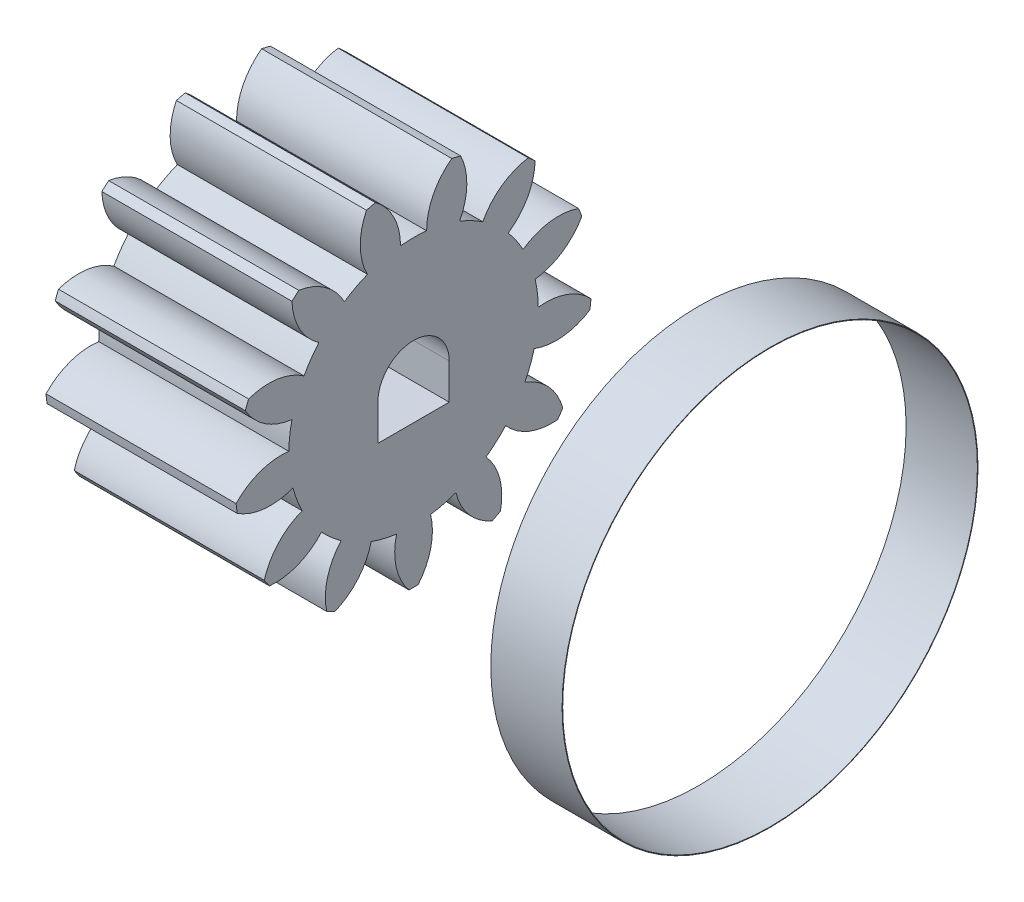
from build123d import *

# Parameters (mm, degrees)
CUT_EXTRUDE1_START         = -10
CUT_EXTRUDE1_DEPTH         = 10
CUT_EXTRUDE2_DEPTH         = 15.577379737
CUT_EXTRUDE3_DEPTH         = 15.577379737
CUT_EXTRUDE4_DEPTH         = 15.577379737
CUT_EXTRUDE5_DEPTH         = 15.577379737
CUT_EXTRUDE6_DEPTH         = 15.577379737
CUT_EXTRUDE7_DEPTH         = 15.577379737
CUT_EXTRUDE8_DEPTH         = 15.577379737
CUT_EXTRUDE9_DEPTH         = 15.577379737
CUT_EXTRUDE10_DEPTH        = 15.559932415
CUT_EXTRUDE11_DEPTH        = 15.559932415
CUT_EXTRUDE12_DEPTH        = 15.559932415
CUT_EXTRUDE13_DEPTH        = 15.559932415
F_0_8_0_8_DIAMETER_HOLE1_D = 0.8
SKETCH20_R                 = 8.75
BOSS_EXTRUDE2_DEPTH        = 3
BOSS_EXTRUDE3_START        = 10
BOSS_EXTRUDE3_DEPTH        = 10
CUT_EXTRUDE14_REACH        = 21.445
SKETCH23_R                 = 8.725
CUT_EXTRUDE15_DEPTH        = 8


with BuildPart() as part:
    # Cut-Extrude1: read off the stored shape, not the designer's step
    # Cut-Extrude1 outline → Cut-Extrude1 (new body)
    with BuildSketch(Plane(origin=(10, 0, 0), x_dir=(0, 0, -1), z_dir=(1, 0, 0)).offset(CUT_EXTRUDE1_START)):
        with BuildLine():
            ThreePointArc((5.115599083, 5.484582575), (-6.172378994, -4.2604856), (6.942190227, 2.838308449))
            ThreePointArc((6.942190227, 2.838308449), (5.736412412, 2.954786958), (4.608733854, 2.512284471))
            ThreePointArc((4.608733854, 2.512284471), (4.319842312, 2.981771856), (3.983306334, 3.41837266))
            ThreePointArc((3.983306334, 3.41837266), (4.796933675, 4.315856884), (5.115599083, 5.484582575))
        make_face()
    extrude(amount=CUT_EXTRUDE1_DEPTH)

    # Sketch3 → Cut-Extrude2 (cut, through all)
    with BuildSketch(Plane(origin=(10, 0, 0), x_dir=(0, 0, -1), z_dir=(1, 0, 0))):
        with BuildLine():
            ThreePointArc((7.466031873, -0.712999344), (7.445316556, 0.904025102), (7.078450644, 2.479019256))
            ThreePointArc((7.078450644, 2.479019256), (6.253152529, 1.592255251), (5.115639582, 1.175683915))
            ThreePointArc((5.115639582, 1.175683915), (5.21072888, 0.632697035), (5.24834797, 0.082732007))
            ThreePointArc((5.24834797, 0.082732007), (6.452498904, -0.049509856), (7.466031873, -0.712999344))
        make_face()
    extrude(amount=-CUT_EXTRUDE2_DEPTH, mode=Mode.SUBTRACT)

    # Sketch4 → Cut-Extrude3 (cut, through all)
    with BuildSketch(Plane(origin=(10, 0, 0), x_dir=(0, 0, -1), z_dir=(1, 0, 0))):
        with BuildLine():
            ThreePointArc((6.279495593, -4.10096758), (7.01262182, -2.659536653), (7.419714468, -1.094457498))
            ThreePointArc((7.419714468, -1.094457498), (6.276849497, -1.496112872), (5.076041451, -1.336339847))
            ThreePointArc((5.076041451, -1.336339847), (4.907900258, -1.861321052), (4.685628816, -2.365773362))
            ThreePointArc((4.685628816, -2.365773362), (5.690395658, -3.042464558), (6.279495593, -4.10096758))
        make_face()
    extrude(amount=-CUT_EXTRUDE3_DEPTH, mode=Mode.SUBTRACT)

    # Sketch5 → Cut-Extrude4 (cut, through all)
    with BuildSketch(Plane(origin=(10, 0, 0), x_dir=(0, 0, -1), z_dir=(1, 0, 0))):
        with BuildLine():
            ThreePointArc((3.654402549, -6.549453566), (4.973419937, -5.613830611), (6.061211124, -4.41720723))
            ThreePointArc((6.061211124, -4.41720723), (4.862595889, -4.241739566), (3.873583397, -3.542224254))
            ThreePointArc((3.873583397, -3.542224254), (3.480730833, -3.928932917), (3.049488568, -4.272308565))
            ThreePointArc((3.049488568, -4.272308565), (3.624691343, -5.338427296), (3.654402549, -6.549453566))
        make_face()
    extrude(amount=-CUT_EXTRUDE4_DEPTH, mode=Mode.SUBTRACT)

    # Sketch6 → Cut-Extrude5 (cut, through all)
    with BuildSketch(Plane(origin=(10, 0, 0), x_dir=(0, 0, -1), z_dir=(1, 0, 0))):
        with BuildLine():
            ThreePointArc((0.192129921, -7.497538669), (1.794867482, -7.282063631), (3.314157357, -6.728028018))
            ThreePointArc((3.314157357, -6.728028018), (2.334380164, -6.015634844), (1.783734068, -4.936627773))
            ThreePointArc((1.783734068, -4.936627773), (1.256167922, -5.0964736), (0.714747239, -5.200109363))
            ThreePointArc((0.714747239, -5.200109363), (0.728613924, -6.411420676), (0.192129921, -7.497538669))
        make_face()
    extrude(amount=-CUT_EXTRUDE5_DEPTH, mode=Mode.SUBTRACT)

    # Sketch7 → Cut-Extrude6 (cut, through all)
    with BuildSketch(Plane(origin=(10, 0, 0), x_dir=(0, 0, -1), z_dir=(1, 0, 0))):
        with BuildLine():
            ThreePointArc((-3.314157357, -6.728028018), (-1.794867482, -7.282063631), (-0.192129921, -7.497538669))
            ThreePointArc((-0.192129921, -7.497538669), (-0.728613924, -6.411420676), (-0.714747239, -5.200109363))
            ThreePointArc((-0.714747239, -5.200109363), (-1.256167922, -5.0964736), (-1.783734068, -4.936627773))
            ThreePointArc((-1.783734068, -4.936627773), (-2.334380164, -6.015634844), (-3.314157357, -6.728028018))
        make_face()
    extrude(amount=-CUT_EXTRUDE6_DEPTH, mode=Mode.SUBTRACT)

    # Sketch8 → Cut-Extrude7 (cut, through all)
    with BuildSketch(Plane(origin=(10, 0, 0), x_dir=(0, 0, -1), z_dir=(1, 0, 0))):
        with BuildLine():
            ThreePointArc((-6.061211124, -4.41720723), (-4.973419937, -5.613830611), (-3.654402549, -6.549453566))
            ThreePointArc((-3.654402549, -6.549453566), (-3.624691343, -5.338427296), (-3.049488568, -4.272308565))
            ThreePointArc((-3.049488568, -4.272308565), (-3.480730833, -3.928932917), (-3.873583397, -3.542224254))
            ThreePointArc((-3.873583397, -3.542224254), (-4.862595889, -4.241739566), (-6.061211124, -4.41720723))
        make_face()
    extrude(amount=-CUT_EXTRUDE7_DEPTH, mode=Mode.SUBTRACT)

    # Sketch9 → Cut-Extrude8 (cut, through all)
    with BuildSketch(Plane(origin=(10, 0, 0), x_dir=(0, 0, -1), z_dir=(1, 0, 0))):
        with BuildLine():
            ThreePointArc((-7.419714468, -1.094457498), (-7.01262182, -2.659536653), (-6.279495593, -4.10096758))
            ThreePointArc((-6.279495593, -4.10096758), (-5.690395658, -3.042464558), (-4.685628816, -2.365773362))
            ThreePointArc((-4.685628816, -2.365773362), (-4.907900258, -1.861321052), (-5.076041451, -1.336339847))
            ThreePointArc((-5.076041451, -1.336339847), (-6.276849497, -1.496112872), (-7.419714468, -1.094457498))
        make_face()
    extrude(amount=-CUT_EXTRUDE8_DEPTH, mode=Mode.SUBTRACT)

    # Sketch10 → Cut-Extrude9 (cut, through all)
    with BuildSketch(Plane(origin=(10, 0, 0), x_dir=(0, 0, -1), z_dir=(1, 0, 0))):
        with BuildLine():
            ThreePointArc((-7.078450644, 2.479019256), (-7.445316556, 0.904025102), (-7.466031873, -0.712999344))
            ThreePointArc((-7.466031873, -0.712999344), (-6.452498904, -0.049509856), (-5.24834797, 0.082732007))
            ThreePointArc((-5.24834797, 0.082732007), (-5.21072888, 0.632697035), (-5.115639582, 1.175683915))
            ThreePointArc((-5.115639582, 1.175683915), (-6.253152529, 1.592255251), (-7.078450644, 2.479019256))
        make_face()
    extrude(amount=-CUT_EXTRUDE9_DEPTH, mode=Mode.SUBTRACT)

    # Sketch11 → Cut-Extrude10 (cut, through all)
    with BuildSketch(Plane(origin=(10, 0, 0), x_dir=(0, 0, -1), z_dir=(1, 0, 0))):
        with BuildLine():
            ThreePointArc((-5.115599083, 5.484582575), (-6.172378994, 4.2604856), (-6.942190227, 2.838308449))
            ThreePointArc((-6.942190227, 2.838308449), (-5.736412412, 2.954786958), (-4.608733854, 2.512284471))
            ThreePointArc((-4.608733854, 2.512284471), (-4.319842312, 2.981771856), (-3.983306334, 3.41837266))
            ThreePointArc((-3.983306334, 3.41837266), (-4.796933675, 4.315856884), (-5.115599083, 5.484582575))
        make_face()
    extrude(amount=-CUT_EXTRUDE10_DEPTH, mode=Mode.SUBTRACT)

    # Sketch12 → Cut-Extrude11 (cut, through all)
    with BuildSketch(Plane(origin=(10, 0, 0), x_dir=(0, 0, -1), z_dir=(1, 0, 0))):
        with BuildLine():
            ThreePointArc((-1.980825421, 7.233694122), (-3.48542379, 6.640920192), (-4.827976462, 5.739393982))
            ThreePointArc((-4.827976462, 5.739393982), (-3.706182968, 5.282177689), (-2.913314353, 4.366302839))
            ThreePointArc((-2.913314353, 4.366302839), (-2.43933193, 4.647758679), (-1.93844561, 4.877953425))
            ThreePointArc((-1.93844561, 4.877953425), (-2.241795126, 6.050747718), (-1.980825421, 7.233694122))
        make_face()
    extrude(amount=-CUT_EXTRUDE11_DEPTH, mode=Mode.SUBTRACT)

    # Sketch13 → Cut-Extrude12 (cut, through all)
    with BuildSketch(Plane(origin=(10, 0, 0), x_dir=(0, 0, -1), z_dir=(1, 0, 0))):
        with BuildLine():
            ThreePointArc((1.607731473, 7.325653521), (0, 7.5), (-1.607731473, 7.325653521))
            ThreePointArc((-1.607731473, 7.325653521), (-0.82691167, 6.399485168), (-0.550489643, 5.220053846))
            ThreePointArc((-0.550489643, 5.220053846), (0, 5.249), (0.550489643, 5.220053846))
            ThreePointArc((0.550489643, 5.220053846), (0.82691167, 6.399485168), (1.607731473, 7.325653521))
        make_face()
    extrude(amount=-CUT_EXTRUDE12_DEPTH, mode=Mode.SUBTRACT)

    # Sketch14 → Cut-Extrude13 (cut, through all)
    with BuildSketch(Plane(origin=(10, 0, 0), x_dir=(0, 0, -1), z_dir=(1, 0, 0))):
        with BuildLine():
            ThreePointArc((4.827976462, 5.739393982), (3.48542379, 6.640920192), (1.980825421, 7.233694122))
            ThreePointArc((1.980825421, 7.233694122), (2.241795126, 6.050747718), (1.93844561, 4.877953425))
            ThreePointArc((1.93844561, 4.877953425), (2.43933193, 4.647758679), (2.913314353, 4.366302839))
            ThreePointArc((2.913314353, 4.366302839), (3.706182968, 5.282177689), (4.827976462, 5.739393982))
        make_face()
    extrude(amount=-CUT_EXTRUDE13_DEPTH, mode=Mode.SUBTRACT)

    # Ø0.8 (0.8) Diameter Hole1 (through all)
    with Locations(Plane(origin=(10, 0, 0), x_dir=(0, 0, -1), z_dir=(1, 0, 0))):
        with Locations((0, 0)):
            Hole(F_0_8_0_8_DIAMETER_HOLE1_D / 2)

    # Sketch20 → Boss-Extrude2 (add)
    with BuildSketch(Plane(origin=(10, 0, 0), x_dir=(0, 0, -1), z_dir=(1, 0, 0))):
        Circle(SKETCH20_R)
    extrude(amount=BOSS_EXTRUDE2_DEPTH)

    # Sketch22 → Boss-Extrude3 (add)
    with BuildSketch(Plane.ZY.offset(BOSS_EXTRUDE3_START)):
        with BuildLine():
            ThreePointArc((-1.93844561, 4.877953425), (-2.43933193, 4.647758679), (-2.913314353, 4.366302839))
            ThreePointArc((-2.913314353, 4.366302839), (-3.706182968, 5.282177689), (-4.827976462, 5.739393982))
            ThreePointArc((-4.827976462, 5.739393982), (-4.973419937, 5.613830611), (-5.115599083, 5.484582575))
            ThreePointArc((-5.115599083, 5.484582575), (-4.796933675, 4.315856884), (-3.983306334, 3.41837266))
            ThreePointArc((-3.983306334, 3.41837266), (-4.319842312, 2.981771856), (-4.608733854, 2.512284471))
            ThreePointArc((-4.608733854, 2.512284471), (-5.736412412, 2.954786958), (-6.942190227, 2.838308449))
            ThreePointArc((-6.942190227, 2.838308449), (-7.01262182, 2.659536653), (-7.078450644, 2.479019256))
            ThreePointArc((-7.078450644, 2.479019256), (-6.253152529, 1.592255251), (-5.115639582, 1.175683915))
            ThreePointArc((-5.115639582, 1.175683915), (-5.21072888, 0.632697035), (-5.24834797, 0.082732007))
            ThreePointArc((-5.24834797, 0.082732007), (-6.452498904, -0.049509856), (-7.466031873, -0.712999344))
            ThreePointArc((-7.466031873, -0.712999344), (-7.445316556, -0.904025102), (-7.419714468, -1.094457498))
            ThreePointArc((-7.419714468, -1.094457498), (-6.276849497, -1.496112872), (-5.076041451, -1.336339847))
            ThreePointArc((-5.076041451, -1.336339847), (-4.907900258, -1.861321052), (-4.685628816, -2.365773362))
            ThreePointArc((-4.685628816, -2.365773362), (-5.690395658, -3.042464558), (-6.279495593, -4.10096758))
            ThreePointArc((-6.279495593, -4.10096758), (-6.172378994, -4.2604856), (-6.061211124, -4.41720723))
            ThreePointArc((-6.061211124, -4.41720723), (-4.862595889, -4.241739566), (-3.873583397, -3.542224254))
            ThreePointArc((-3.873583397, -3.542224254), (-3.480730833, -3.928932917), (-3.049488568, -4.272308565))
            ThreePointArc((-3.049488568, -4.272308565), (-3.624691343, -5.338427296), (-3.654402549, -6.549453566))
            ThreePointArc((-3.654402549, -6.549453566), (-3.48542379, -6.640920192), (-3.314157357, -6.728028018))
            ThreePointArc((-3.314157357, -6.728028018), (-2.334380164, -6.015634844), (-1.783734068, -4.936627773))
            ThreePointArc((-1.783734068, -4.936627773), (-1.256167922, -5.0964736), (-0.714747239, -5.200109363))
            ThreePointArc((-0.714747239, -5.200109363), (-0.728613924, -6.411420676), (-0.192129921, -7.497538669))
            ThreePointArc((-0.192129921, -7.497538669), (0, -7.5), (0.192129921, -7.497538669))
            ThreePointArc((0.192129921, -7.497538669), (0.728613924, -6.411420676), (0.714747239, -5.200109363))
            ThreePointArc((0.714747239, -5.200109363), (1.256167922, -5.0964736), (1.783734068, -4.936627773))
            ThreePointArc((1.783734068, -4.936627773), (2.334380164, -6.015634844), (3.314157357, -6.728028018))
            ThreePointArc((3.314157357, -6.728028018), (3.48542379, -6.640920192), (3.654402549, -6.549453566))
            ThreePointArc((3.654402549, -6.549453566), (3.624691343, -5.338427296), (3.049488568, -4.272308565))
            ThreePointArc((3.049488568, -4.272308565), (3.480730833, -3.928932917), (3.873583397, -3.542224254))
            ThreePointArc((3.873583397, -3.542224254), (4.862595889, -4.241739566), (6.061211124, -4.41720723))
            ThreePointArc((6.061211124, -4.41720723), (6.172378994, -4.2604856), (6.279495593, -4.10096758))
            ThreePointArc((6.279495593, -4.10096758), (5.690395658, -3.042464558), (4.685628816, -2.365773362))
            ThreePointArc((4.685628816, -2.365773362), (4.907900258, -1.861321052), (5.076041451, -1.336339847))
            ThreePointArc((5.076041451, -1.336339847), (6.276849497, -1.496112872), (7.419714468, -1.094457498))
            ThreePointArc((7.419714468, -1.094457498), (7.445316556, -0.904025102), (7.466031873, -0.712999344))
            ThreePointArc((7.466031873, -0.712999344), (6.452498904, -0.049509856), (5.24834797, 0.082732007))
            ThreePointArc((5.24834797, 0.082732007), (5.21072888, 0.632697035), (5.115639582, 1.175683915))
            ThreePointArc((5.115639582, 1.175683915), (6.253152529, 1.592255251), (7.078450644, 2.479019256))
            ThreePointArc((7.078450644, 2.479019256), (7.01262182, 2.659536653), (6.942190227, 2.838308449))
            ThreePointArc((6.942190227, 2.838308449), (5.736412412, 2.954786958), (4.608733854, 2.512284471))
            ThreePointArc((4.608733854, 2.512284471), (4.319842312, 2.981771856), (3.983306334, 3.41837266))
            ThreePointArc((3.983306334, 3.41837266), (4.796933675, 4.315856884), (5.115599083, 5.484582575))
            ThreePointArc((5.115599083, 5.484582575), (4.973419937, 5.613830611), (4.827976462, 5.739393982))
            ThreePointArc((4.827976462, 5.739393982), (3.706182968, 5.282177689), (2.913314353, 4.366302839))
            ThreePointArc((2.913314353, 4.366302839), (2.43933193, 4.647758679), (1.93844561, 4.877953425))
            ThreePointArc((1.93844561, 4.877953425), (2.241795126, 6.050747718), (1.980825421, 7.233694122))
            ThreePointArc((1.980825421, 7.233694122), (1.794867482, 7.282063631), (1.607731473, 7.325653521))
            ThreePointArc((1.607731473, 7.325653521), (0.82691167, 6.399485168), (0.550489643, 5.220053846))
            ThreePointArc((0.550489643, 5.220053846), (0, 5.249), (-0.550489643, 5.220053846))
            ThreePointArc((-0.550489643, 5.220053846), (-0.82691167, 6.399485168), (-1.607731473, 7.325653521))
            ThreePointArc((-1.607731473, 7.325653521), (-1.794867482, 7.282063631), (-1.980825421, 7.233694122))
            ThreePointArc((-1.980825421, 7.233694122), (-2.241795126, 6.050747718), (-1.93844561, 4.877953425))
        make_face()
    extrude(amount=-BOSS_EXTRUDE3_DEPTH)

    # Sketch23 → Cut-Extrude14 (cut, up to next)
    with BuildSketch(Plane.ZY.offset(2), mode=Mode.PRIVATE) as cut_extrude14_sk1:
        with Locations(Location((0, 0, 0), (0, 0, 180))):
            Circle(SKETCH23_R)
    cut_extrude14_tool1 = extrude(cut_extrude14_sk1.sketch, amount=-CUT_EXTRUDE14_REACH, mode=Mode.PRIVATE) & part.part
    add(cut_extrude14_tool1.solids().sort_by_distance((-2, 0, 0))[0], mode=Mode.SUBTRACT)


with BuildPart() as cut_extrude14_piece_1:
    # of the separate pieces the step leaves, piece 1, a body of its own (cut_extrude14_pieces)
    add(part.part.solids().sort_by_distance((-2, 5.739393982, -4.827976462))[0])

    # Sketch24 → Cut-Extrude15 (cut)
    with BuildSketch(Plane.ZY.offset(10)):
        with BuildLine():
            Line((-1.5, 0), (-1.5, -1.5))
            Line((-1.5, -1.5), (1.5, -1.5))
            Line((1.5, -1.5), (1.5, 0))
            ThreePointArc((1.5, 0), (0, 1.5), (-1.5, 0))
        make_face()
    extrude(amount=-CUT_EXTRUDE15_DEPTH, mode=Mode.SUBTRACT)


with BuildPart() as cut_extrude14_piece_2:
    # of the separate pieces the step leaves, piece 2, a body of its own (cut_extrude14_pieces)
    add(part.part.solids().sort_by_distance((10, 0, -8.75))[0])


solid = Compound([cut_extrude14_piece_1.part, cut_extrude14_piece_2.part])
